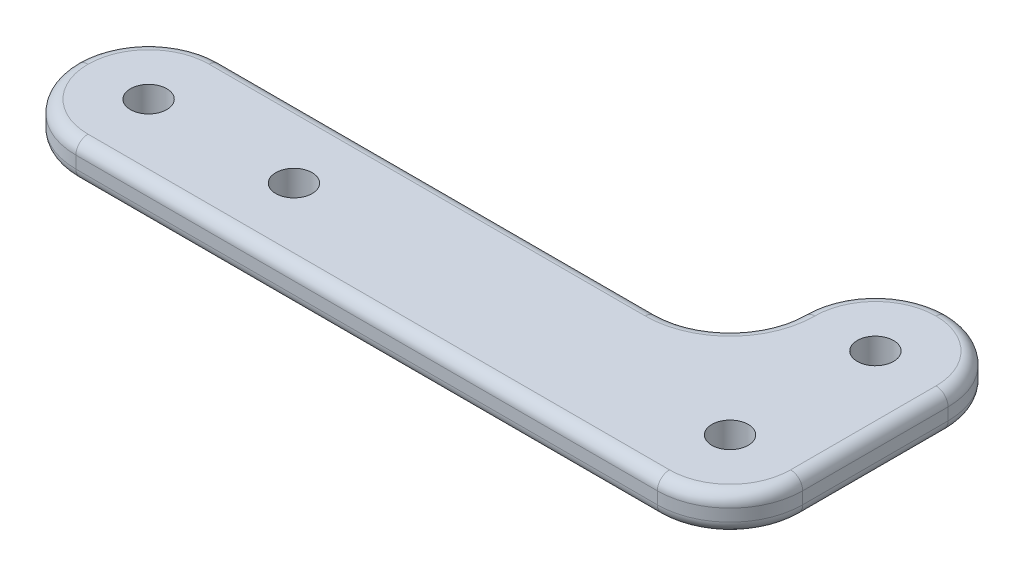
from build123d import *

# Parameters (mm, degrees)
SKETCH1_R           = 3.175
BOSS_EXTRUDE1_DEPTH = 6.35
FILLET2_R           = 12.7
FILLET3_R           = 2.116666667


with BuildPart() as part:
    # Sketch1 → Boss-Extrude1 (new body)
    with BuildSketch(Plane(origin=(0, 0, 0), x_dir=(1, 0, 0), z_dir=(0, 1, 0))):
        with BuildLine():
            Line((12.7, 25.4), (-12.7, 25.4))
            Line((-12.7, 25.4), (-12.7, 0))
            Line((-12.7, 0), (-114.3, 0))
            Line((-114.3, 0), (-114.3, -25.4))
            Line((-114.3, -25.4), (0, -25.4))
            ThreePointArc((0, -25.4), (8.980256121, -21.680256121), (12.7, -12.7))
            Line((12.7, -12.7), (12.7, 25.4))
        make_face()
        with Locations(Location((-76.2, -12.7, 0), (0, 0, 270))):
            Circle(SKETCH1_R, mode=Mode.SUBTRACT)
        with Locations(Location((-101.6, -12.7, 0), (0, 0, 270))):
            Circle(SKETCH1_R, mode=Mode.SUBTRACT)
        with Locations(Location((0, -12.7, 0), (0, 0, 270))):
            Circle(SKETCH1_R, mode=Mode.SUBTRACT)
        with Locations(Location((0, 12.7, 0), (0, 0, 270))):
            Circle(SKETCH1_R, mode=Mode.SUBTRACT)
    extrude(amount=BOSS_EXTRUDE1_DEPTH)

    # Fillet2
    fillet2_edges = [part.edges().sort_by_distance(p)[0] for p in [
        (12.7, 3.175, -25.4),
        (-12.7, 3.175, -25.4),
        (-114.3, 3.175, 0),
        (-114.3, 3.175, 25.4),
        (-12.7, 3.175, 0),
    ]]
    fillet(fillet2_edges, radius=FILLET2_R - 0.0001)  # a hair under: the kernel refuses the full size

    # Fillet3
    fillet3_edges = [part.edges().sort_by_distance(p)[0] for p in [
        (8.980256121, 6.35, 21.680256121),
        (12.7, 0, -5e-05),
        (12.7, 6.35, -5e-05),
        (8.980256121, 0, 21.680256121),
        (-63.5, 0, 0),
        (-63.5, 6.35, 0),
        (-50.80005, 0, 25.4),
        (-110.58028541, 0, 21.68028541),
        (-110.58028541, 0, 3.71971459),
        (-8.98028541, 0, -21.68028541),
        (8.98028541, 0, -21.68028541),
        (-50.80005, 6.35, 25.4),
        (-110.58028541, 6.35, 21.68028541),
        (-110.58028541, 6.35, 3.71971459),
        (-8.98028541, 6.35, -21.68028541),
        (8.98028541, 6.35, -21.68028541),
        (-16.41971459, 0, -3.71971459),
        (-16.41971459, 6.35, -3.71971459),
    ]]
    fillet(fillet3_edges, radius=FILLET3_R)


solid = part.part
